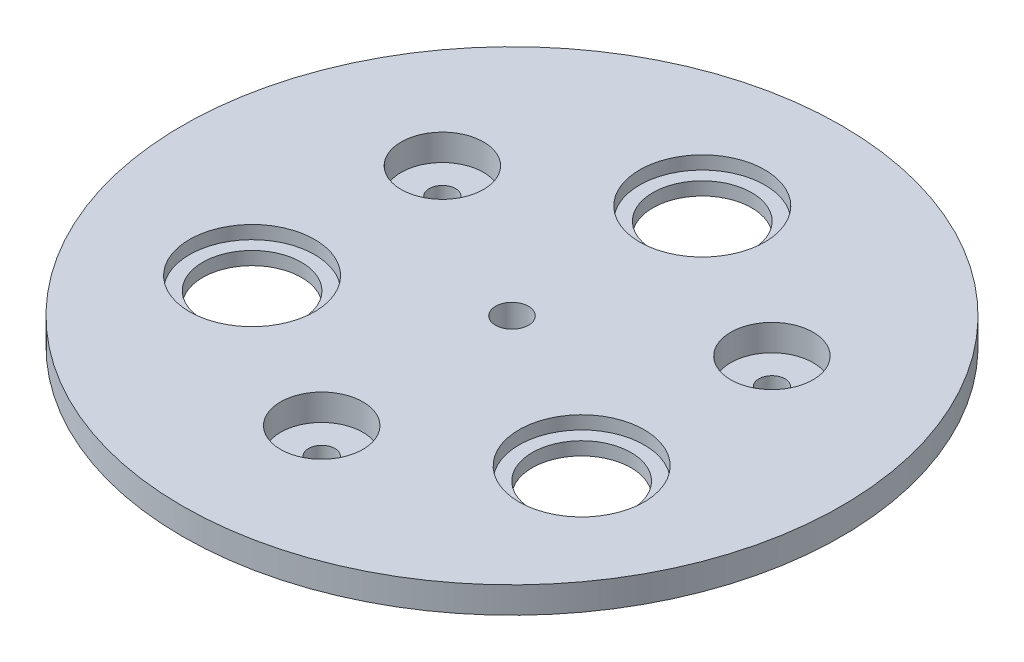
from build123d import *

# Parameters (mm, degrees)
CROQUIS3_R                 = 50
CROQUIS3_R_2               = 7.5
CROQUIS3_R_3               = 2.5
SALIENTE_EXTRUIR1_DEPTH    = 2
SALIENTE_EXTRUIR2_START    = 2
CROQUIS4_R                 = 50
CROQUIS4_R_2               = 9.5
CROQUIS4_R_3               = 2.5
SALIENTE_EXTRUIR2_DEPTH    = 2
CORTAR_EXTRUIR1_DEPTH      = 71.738956735
CORTAR_EXTRUIR1_DEPTH_BACK = 71.738956735
CROQUIS1_R                 = 6.25
CROQUIS5_R                 = 9.25
CROQUIS5_R_2               = 2
CROQUIS5_R_3               = 9.75
CROQUIS5_R_4               = 6.25
SALIENTE_EXTRUIR3_DEPTH    = 3


with BuildPart() as part:
    # Croquis3 → Saliente-Extruir1 (new body)
    with BuildSketch(Plane(origin=(0, 0, 0), x_dir=(1, 0, 0), z_dir=(0, 1, 0))):
        Circle(CROQUIS3_R)
        with Locations((0, 28.867513459)):
            Circle(CROQUIS3_R_2, mode=Mode.SUBTRACT)
        Circle(CROQUIS3_R_3, mode=Mode.SUBTRACT)
        with Locations((-25, -14.43375673)):
            Circle(CROQUIS3_R_2, mode=Mode.SUBTRACT)
        with Locations((25, -14.43375673)):
            Circle(CROQUIS3_R_2, mode=Mode.SUBTRACT)
    extrude(amount=-SALIENTE_EXTRUIR1_DEPTH)

    # Croquis4 → Saliente-Extruir2 (add)
    with BuildSketch(Plane(origin=(0, 0, 0), x_dir=(1, 0, 0), z_dir=(0, 1, 0)).offset(SALIENTE_EXTRUIR2_START)):
        Circle(CROQUIS4_R)
        with Locations((-25, -14.43375673)):
            Circle(CROQUIS4_R_2, mode=Mode.SUBTRACT)
        with Locations((25, -14.43375673)):
            Circle(CROQUIS4_R_2, mode=Mode.SUBTRACT)
        Circle(CROQUIS4_R_3, mode=Mode.SUBTRACT)
        with Locations((0, 28.867513459)):
            Circle(CROQUIS4_R_2, mode=Mode.SUBTRACT)
    extrude(amount=-SALIENTE_EXTRUIR2_DEPTH)

    # Croquis1 → Cortar-Extruir1 (cut, two sides: drawn at the far end of the back side and taken through both)
    with BuildSketch(Plane(origin=(0, 0, 0), x_dir=(1, 0, 0), z_dir=(0, 1, 0)).offset(-CORTAR_EXTRUIR1_DEPTH_BACK)):
        with Locations((25, 14.43375673)):
            Circle(CROQUIS1_R)
        with Locations((-25, 14.43375673)):
            Circle(CROQUIS1_R)
        with Locations((0, -28.867513459)):
            Circle(CROQUIS1_R)
    extrude(amount=CORTAR_EXTRUIR1_DEPTH + CORTAR_EXTRUIR1_DEPTH_BACK, mode=Mode.SUBTRACT)

    # Croquis5 → Saliente-Extruir3 (add)
    # profile 1 of 4: a face of its own
    with BuildSketch(Plane.XZ.offset(2)):
        with Locations((25, -14.43375673)):
            Circle(CROQUIS5_R)
        with Locations((25, -14.43375673)):
            Circle(CROQUIS5_R_2, mode=Mode.SUBTRACT)
    # profile 2 of 4: a face of its own
    with BuildSketch(Plane.XZ.offset(2)):
        with Locations((-25, -14.43375673)):
            Circle(CROQUIS5_R)
        with Locations((-25, -14.43375673)):
            Circle(CROQUIS5_R_2, mode=Mode.SUBTRACT)
    # profile 3 of 4: a face of its own
    with BuildSketch(Plane.XZ.offset(2)):
        with Locations((0, 28.867513459)):
            Circle(CROQUIS5_R)
        with Locations((0, 28.867513459)):
            Circle(CROQUIS5_R_2, mode=Mode.SUBTRACT)
    # profile 4 of 4: a face of its own
    with BuildSketch(Plane.XZ.offset(2)):
        Circle(CROQUIS5_R_3)
        Circle(CROQUIS5_R_4, mode=Mode.SUBTRACT)
    extrude(amount=SALIENTE_EXTRUIR3_DEPTH)


solid = part.part
